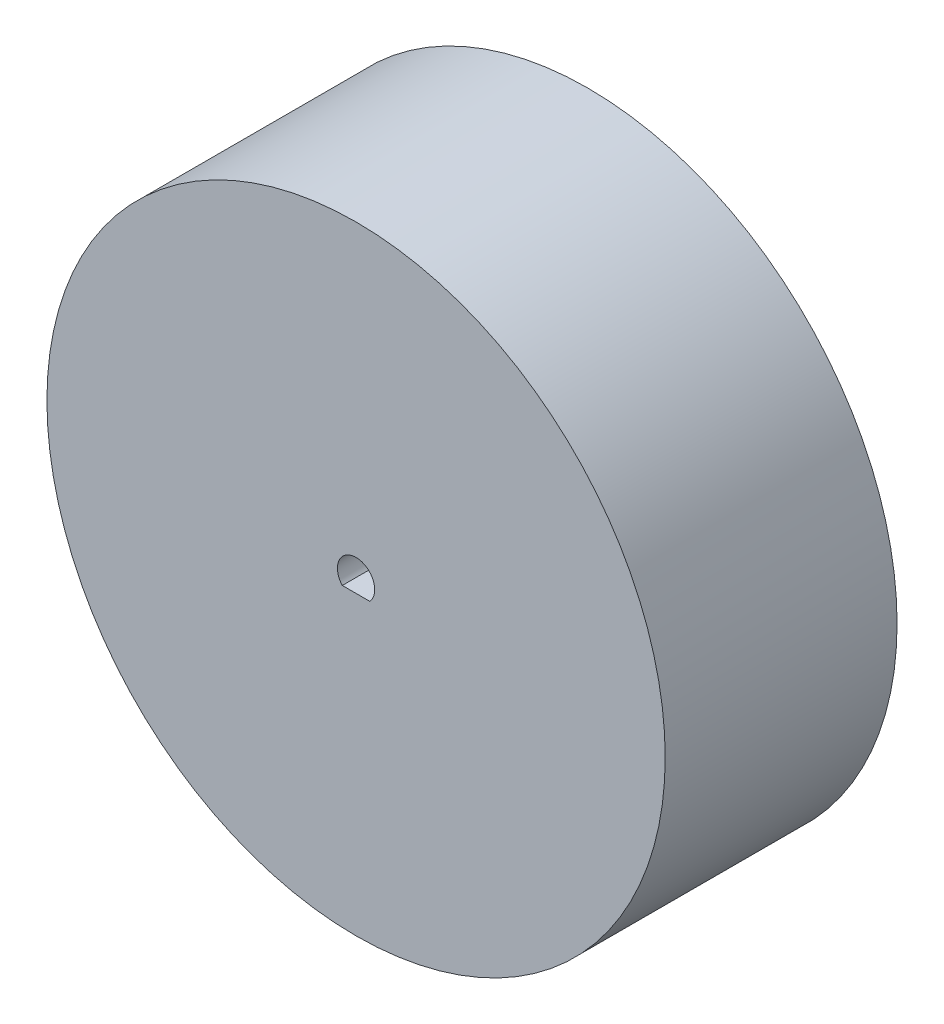
from build123d import *

# Parameters (mm, degrees)
SKETCH1_R           = 25.4
BOSS_EXTRUDE1_DEPTH = 9.525


with BuildPart() as part:
    # Sketch1 → Boss-Extrude1 (new, symmetric)
    with BuildSketch(Plane.XY):
        Circle(SKETCH1_R)
        with BuildLine():
            Line((-1.13137085, -1.03), (-0.830662386, -1.03))
            Line((-0.830662386, -1.03), (0.830662386, -1.03))
            Line((0.830662386, -1.03), (1.13137085, -1.03))
            ThreePointArc((1.13137085, -1.03), (1.426866742, -0.552223958), (1.53, 0))
            ThreePointArc((1.53, 0), (0, 1.53), (-1.53, 0))
            ThreePointArc((-1.53, 0), (-1.426866742, -0.552223958), (-1.13137085, -1.03))
        make_face(mode=Mode.SUBTRACT)
    extrude(amount=BOSS_EXTRUDE1_DEPTH, both=True)


solid = part.part
